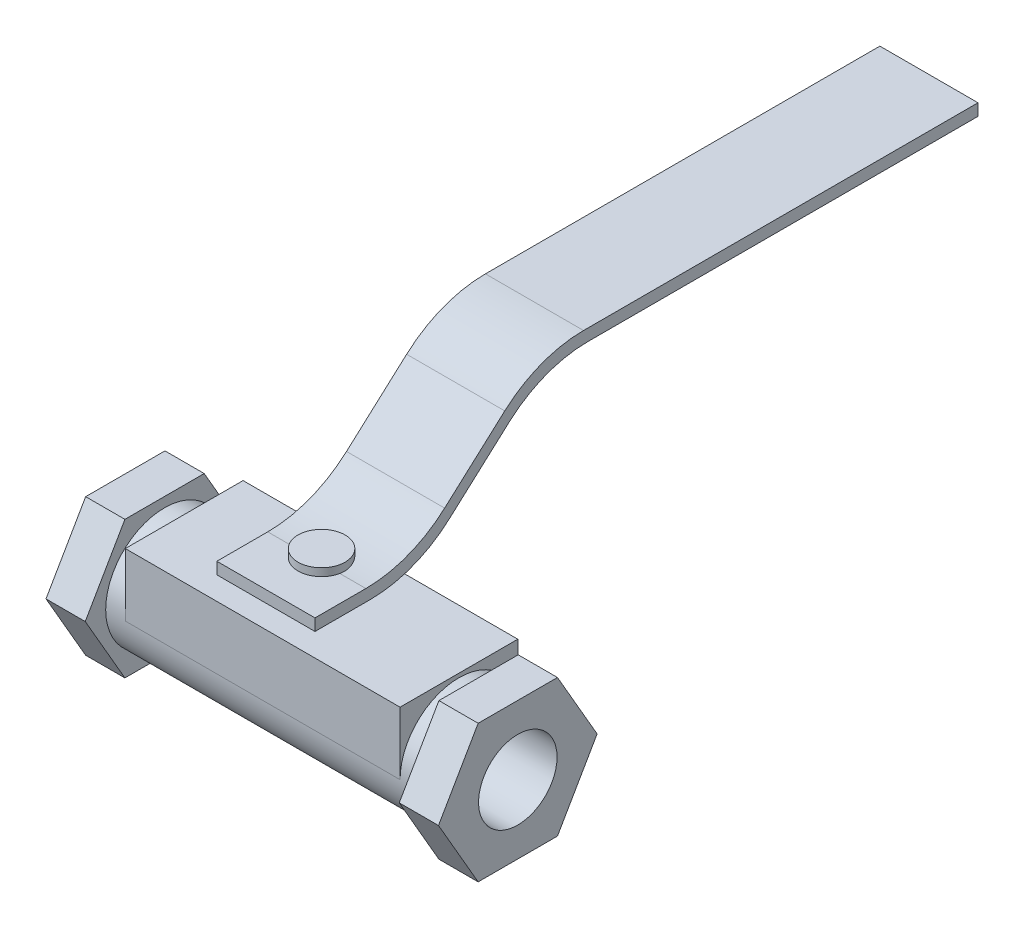
from build123d import *

# Parameters (mm, degrees)
SKETCH1_R               = 15
SKETCH1_R_2             = 5
EXTRUDE_THIN1_DEPTH     = 50
SKETCH2_W               = 70
SKETCH2_H               = 30
BOSS_EXTRUDE1_DEPTH     = 16
SKETCH3_R               = 6
BOSS_EXTRUDE2_DEPTH     = 10
EXTRUDE_THIN2_DEPTH     = 12.5
FILLET1_R               = 30
BOSS_EXTRUDE3_DEPTH     = 10
CUT_EXTRUDE1_DEPTH      = 172.116081143
CUT_EXTRUDE1_DEPTH_BACK = 172.116081143
SKETCH6_R               = 10


with BuildPart() as part:
    # Sketch1 → Extrude-Thin1 (new, symmetric)
    with BuildSketch(Plane(origin=(0, 0, 0), x_dir=(0, 0, -1), z_dir=(1, 0, 0))):
        Circle(SKETCH1_R)
        Circle(SKETCH1_R_2, mode=Mode.SUBTRACT)
    extrude(amount=EXTRUDE_THIN1_DEPTH, both=True)

    # Sketch2 → Boss-Extrude1 (add)
    with BuildSketch(Plane(origin=(0, 0, 0), x_dir=(1, 0, 0), z_dir=(0, 1, 0))):
        Rectangle(SKETCH2_W, SKETCH2_H)
    extrude(amount=BOSS_EXTRUDE1_DEPTH)

    # Sketch3 → Boss-Extrude2 (add)
    with BuildSketch(Plane(origin=(0, 16, 0), x_dir=(1, 0, 0), z_dir=(0, 1, 0))):
        with Locations(Location((0, 0, 0), (0, 0, 270))):
            Circle(SKETCH3_R)
    extrude(amount=BOSS_EXTRUDE2_DEPTH)

    # Sketch4 → Extrude-Thin2 (add, symmetric)
    with BuildSketch(Plane(origin=(0, 0, 0), x_dir=(0, 0, -1), z_dir=(1, 0, 0))):
        Polygon((-14.175668382, 24.036944014), (10.301514998, 24.036944014), (42.733043078, 53.23603901), (154.74701088, 53.23603901), (154.74701088, 50.23603901), (43.884565313, 50.23603901), (11.453037232, 21.036944014), (-14.175668382, 21.036944014), align=None)
    extrude(amount=EXTRUDE_THIN2_DEPTH, both=True)

    # Fillet1
    # the kernel refuses this fillet: 30 mm, written as the material it adds along each edge
    with BuildSketch(Plane(origin=(12.5, 50.23603901, -43.884565313), x_dir=(0, -0.6691004351822665, 0.7431719906178524), z_dir=(-1, 0, 0))) as fillet1_piece_1:
        with BuildLine():
            CenterArc((FILLET1_R * 0.383840744794, -FILLET1_R), FILLET1_R, 90, 41.997673873)
            Line((-FILLET1_R * 0.285259690389, -FILLET1_R * 0.256828009382), (0, 0))
            Line((0, 0), (FILLET1_R * 0.383840744794, 0))
        make_face()
    extrude(amount=25)
    with BuildSketch(Plane(origin=(12.5, 24.036944014, -10.301514998), x_dir=(0, 0, 1), z_dir=(-1, 0, 0))) as fillet1_piece_2:
        with BuildLine():
            CenterArc((FILLET1_R * 0.383840744794, FILLET1_R), FILLET1_R, 228.002326127, 41.997673873)
            Line((-FILLET1_R * 0.285259690389, FILLET1_R * 0.256828009382), (0, 0))
            Line((0, 0), (FILLET1_R * 0.383840744794, 0))
        make_face()
    extrude(amount=25)
    # the kernel refuses this fillet: 30 mm, written as the material it takes off along each edge
    with BuildSketch(Plane(origin=(41.28805586, 53.23603901, -42.733043078), x_dir=(0, -0.6691004351822663, 0.7431719906178528), z_dir=(-1, 0, 0))) as fillet1_2_piece_1:
        with BuildLine():
            CenterArc((FILLET1_R * 0.383840744794, -FILLET1_R), FILLET1_R, 90, 41.997673873)
            Line((-FILLET1_R * 0.285259690389, -FILLET1_R * 0.256828009382), (0, 0))
            Line((0, 0), (FILLET1_R * 0.383840744794, 0))
        make_face()
    extrude(amount=82.576111719, mode=Mode.SUBTRACT)
    with BuildSketch(Plane(origin=(-41.28805586, 21.036944014, -11.453037232), x_dir=(0, 0, 1), z_dir=(1, 0, 0))) as fillet1_2_piece_2_section:
        with BuildLine():
            CenterArc((FILLET1_R * 0.383840744794, -FILLET1_R), FILLET1_R, 90, 41.997673873)
            Line((-FILLET1_R * 0.285259690389, -FILLET1_R * 0.256828009382), (0, 0))
            Line((0, 0), (FILLET1_R * 0.383840744794, 0))
        make_face()
    fillet1_2_piece_2 = extrude(amount=82.576111719, mode=Mode.PRIVATE)
    fillet1_2_piece_2 = fillet1_2_piece_2 - Plane(origin=(0, 22.678661346, 0), x_dir=(0, 0, 1), z_dir=(0, -1, 0)) * Cylinder(6, 212, mode=Mode.PRIVATE)
    add(fillet1_2_piece_2, mode=Mode.SUBTRACT)

    # Sketch5 → Boss-Extrude3 (add)
    with BuildSketch(Plane(origin=(50, 0, 0), x_dir=(0, 0, -1), z_dir=(1, 0, 0))):
        Polygon((-20.207259422, 0), (-10.103629711, -17.5), (10.103629711, -17.5), (20.207259422, 0), (10.103629711, 17.5), (-10.103629711, 17.5), align=None)
    boss_extrude3 = extrude(amount=-BOSS_EXTRUDE3_DEPTH)

    # Mirror1: Boss-Extrude3 across plane
    add(boss_extrude3.mirror(Plane(origin=(0, 0, 0), x_dir=(0, 0, 1), z_dir=(1, 0, 0))))

    # Sketch6 → Cut-Extrude1 (cut, two sides: drawn at the far end of the back side and taken through both)
    with BuildSketch(Plane(origin=(0, 0, 0), x_dir=(0, 0, -1), z_dir=(1, 0, 0)).offset(-CUT_EXTRUDE1_DEPTH_BACK)):
        Circle(SKETCH6_R)
    extrude(amount=CUT_EXTRUDE1_DEPTH + CUT_EXTRUDE1_DEPTH_BACK, mode=Mode.SUBTRACT)


solid = part.part
